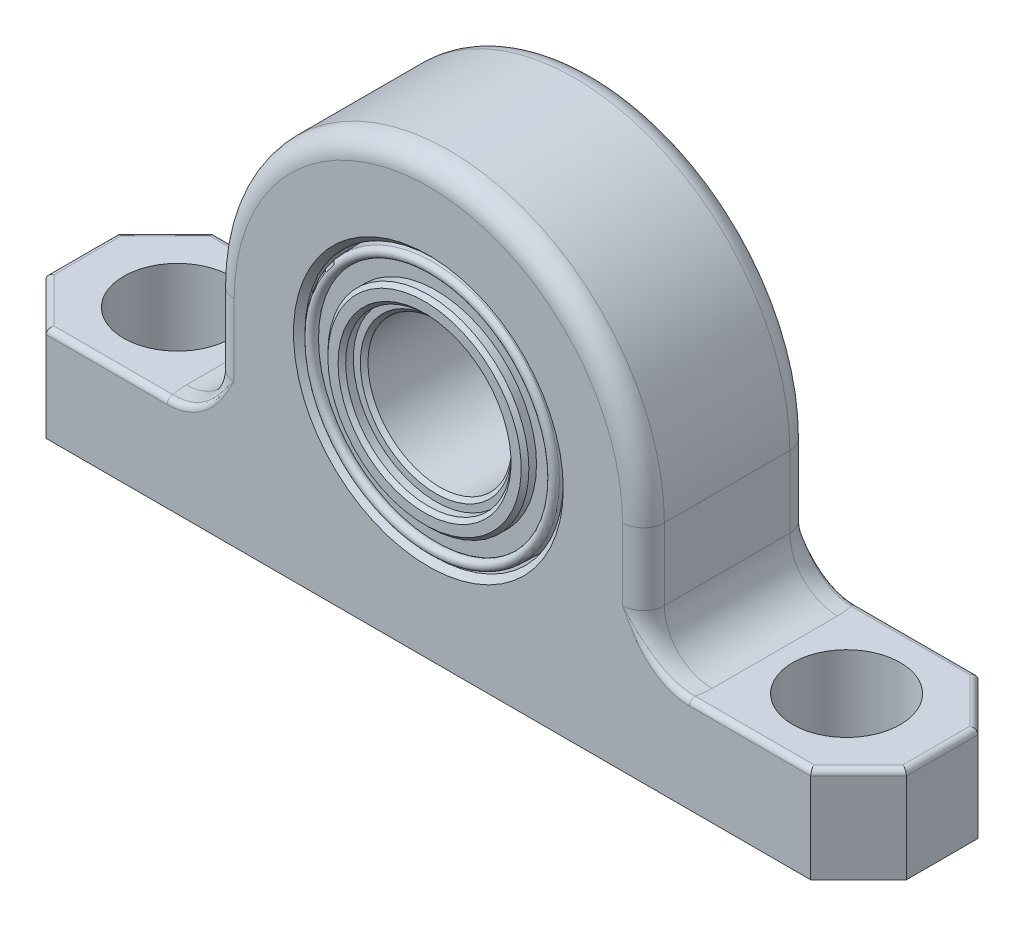
from build123d import *

# Parameters (mm, degrees)
BOSS_EXTRUDE1_DEPTH      = 5.55625
BOSS_EXTRUDE1_DEPTH_BACK = 5.55625
SKETCH3_R                = 8.58012
SKETCH4_R                = 3.571875
CUT_EXTRUDE1_DEPTH       = 41.791336875
CHAMFER1_SIZE            = 3.175
FILLET1_R                = 1.3890625
FILLET2_R                = 3.175
CHAMFER2_SIZE            = 0.381
FILLET3_R                = 0.381
CHAMFER3_SIZE            = 0.254


with BuildPart() as part:
    # Sketch3 → Boss-Extrude1 (new, two sides: drawn at the far end of the back side and taken through both)
    with BuildSketch(Plane.XY.offset(-BOSS_EXTRUDE1_DEPTH_BACK)):
        with BuildLine():
            Line((-28.575, 0), (-28.575, 6.35))
            Line((-28.575, 6.35), (-14.2875, 6.35))
            Line((-14.2875, 6.35), (-14.2875, 14.2875))
            ThreePointArc((-14.2875, 14.2875), (0, 28.575), (14.2875, 14.2875))
            Line((14.2875, 14.2875), (14.2875, 6.35))
            Line((14.2875, 6.35), (28.575, 6.35))
            Line((28.575, 6.35), (28.575, 0))
            Line((28.575, 0), (-28.575, 0))
        make_face()
        with Locations((0, 14.2875)):
            Circle(SKETCH3_R, mode=Mode.SUBTRACT)
    extrude(amount=BOSS_EXTRUDE1_DEPTH + BOSS_EXTRUDE1_DEPTH_BACK)

    # Sketch4 → Cut-Extrude1 (cut, through all)
    with BuildSketch(Plane(origin=(0, 0, 0), x_dir=(1, 0, 0), z_dir=(0, 1, 0))):
        with Locations(Location((-22.225, 0, 0), (0, 0, 270))):
            Circle(SKETCH4_R)
        with Locations(Location((22.225, 0, 0), (0, 0, 270))):
            Circle(SKETCH4_R)
    extrude(amount=CUT_EXTRUDE1_DEPTH, mode=Mode.SUBTRACT)

    # Chamfer1
    chamfer1_edges = [part.edges().sort_by_distance(p)[0] for p in [
        (28.575, 3.175, 5.55625),
        (-28.575, 3.175, -5.55625),
        (-28.575, 3.175, 5.55625),
        (28.575, 3.175, -5.55625),
    ]]
    chamfer(chamfer1_edges, length=CHAMFER1_SIZE)

    # Fillet1
    fillet1_edges = [part.edges().sort_by_distance(p)[0] for p in [
        (14.2875, 10.31875, -5.55625),
        (0, 28.575, -5.55625),
        (-14.2875, 10.31875, -5.55625),
        (14.2875, 10.31875, 5.55625),
        (0, 28.575, 5.55625),
        (-14.2875, 10.31875, 5.55625),
    ]]
    fillet(fillet1_edges, radius=FILLET1_R)

    # Fillet2
    # the kernel refuses this fillet: 3.175 mm, written as the material it adds along each edge
    with BuildSketch(Plane(origin=(-14.2875, 6.35, 4.1671875), x_dir=(-1, 0, 0), z_dir=(0, 0, -1))) as fillet2_piece_1:
        with BuildLine():
            CenterArc((FILLET2_R, FILLET2_R), FILLET2_R, 180, 90)
            Line((0, FILLET2_R), (0, 0))
            Line((0, 0), (FILLET2_R, 0))
        make_face()
    extrude(amount=8.334375)
    with BuildSketch(Plane(origin=(14.2875, 6.35, 4.1671875), x_dir=(1, 0, 0), z_dir=(0, 0, -1))) as fillet2_piece_2:
        with BuildLine():
            CenterArc((FILLET2_R, -FILLET2_R), FILLET2_R, 90, 90)
            Line((0, -FILLET2_R), (0, 0))
            Line((0, 0), (FILLET2_R, 0))
        make_face()
    extrude(amount=8.334375)
    with BuildSketch(Plane(origin=(-12.8984375, 6.35, -4.1671875), x_dir=(-0.9999802608561372, 0, 0.006283143965558251), z_dir=(-0.006283143965558251, 0, -0.9999802608561372))) as fillet2_piece_3_section:
        with BuildLine():
            CenterArc((1.3890625 + FILLET2_R, FILLET2_R), FILLET2_R, 180, 90)
            Line((1.3890625, FILLET2_R), (1.3890625, 0))
            Line((1.3890625, 0), (1.3890625 + FILLET2_R, 0))
        make_face()
    fillet2_piece_3 = revolve(axis=Axis((-12.8984375, 6.35, -4.1671875), (0, 1, 0)), revolution_arc=359.64, mode=Mode.PRIVATE)
    fillet2_piece_3 = split(fillet2_piece_3, bisect_by=Plane(origin=(-12.8984375, 6.35, -5.55625), z_dir=(0, 0, 1)), keep=Keep.TOP, mode=Mode.PRIVATE)
    add(fillet2_piece_3)
    with BuildSketch(Plane(origin=(-12.8984375, 6.35, 4.1671875), x_dir=(-0.9999802608561372, 0, -0.006283143965558251), z_dir=(-0.006283143965558251, 0, 0.9999802608561372))) as fillet2_piece_4_section:
        with BuildLine():
            CenterArc((1.3890625 + FILLET2_R, -FILLET2_R), FILLET2_R, 90, 90)
            Line((1.3890625, -FILLET2_R), (1.3890625, 0))
            Line((1.3890625, 0), (1.3890625 + FILLET2_R, 0))
        make_face()
    fillet2_piece_4 = revolve(axis=Axis((-12.8984375, 6.35, 4.1671875), (0, -1, 0)), revolution_arc=359.64, mode=Mode.PRIVATE)
    fillet2_piece_4 = split(fillet2_piece_4, bisect_by=Plane(origin=(-12.8984375, 6.35, 5.55625), z_dir=(0, 0, -1)), keep=Keep.TOP, mode=Mode.PRIVATE)
    add(fillet2_piece_4)
    with BuildSketch(Plane(origin=(12.8984375, 6.35, -4.1671875), x_dir=(0.9999802608561372, 0, 0.006283143965558251), z_dir=(0.006283143965558251, 0, -0.9999802608561372))) as fillet2_piece_5_section:
        with BuildLine():
            CenterArc((1.3890625 + FILLET2_R, -FILLET2_R), FILLET2_R, 90, 90)
            Line((1.3890625, -FILLET2_R), (1.3890625, 0))
            Line((1.3890625, 0), (1.3890625 + FILLET2_R, 0))
        make_face()
    fillet2_piece_5 = revolve(axis=Axis((12.8984375, 6.35, -4.1671875), (0, -1, 0)), revolution_arc=359.64, mode=Mode.PRIVATE)
    fillet2_piece_5 = split(fillet2_piece_5, bisect_by=Plane(origin=(12.8984375, 6.35, -5.55625), z_dir=(0, 0, 1)), keep=Keep.TOP, mode=Mode.PRIVATE)
    add(fillet2_piece_5)
    with BuildSketch(Plane(origin=(12.8984375, 6.35, 4.1671875), x_dir=(0.9999802608561372, 0, -0.006283143965558251), z_dir=(0.006283143965558251, 0, 0.9999802608561372))) as fillet2_piece_6_section:
        with BuildLine():
            CenterArc((1.3890625 + FILLET2_R, FILLET2_R), FILLET2_R, 180, 90)
            Line((1.3890625, FILLET2_R), (1.3890625, 0))
            Line((1.3890625, 0), (1.3890625 + FILLET2_R, 0))
        make_face()
    fillet2_piece_6 = revolve(axis=Axis((12.8984375, 6.35, 4.1671875), (0, 1, 0)), revolution_arc=359.64, mode=Mode.PRIVATE)
    fillet2_piece_6 = split(fillet2_piece_6, bisect_by=Plane(origin=(12.8984375, 6.35, 5.55625), z_dir=(0, 0, -1)), keep=Keep.TOP, mode=Mode.PRIVATE)
    add(fillet2_piece_6)

    # Chamfer2
    chamfer2_edges = [part.edges().sort_by_distance(p)[0] for p in [
        (-8.58012, 14.2875, -5.55625),
        (-8.58012, 14.2875, 5.55625),
    ]]
    chamfer(chamfer2_edges, length=CHAMFER2_SIZE)

    # Fillet3
    fillet3_edges = [part.edges().sort_by_distance(p)[0] for p in [
        (-21.32299265, 6.35, -5.55625),
        (-21.32299265, 6.35, 5.55625),
        (-14.671838579, 7.348302589, -5.55625),
        (-14.67183858, 7.348302588, 5.55625),
        (14.67183858, 7.348302588, -5.55625),
        (14.671838579, 7.348302589, 5.55625),
        (-28.575, 6.35, 0),
        (21.32299265, 6.35, -5.55625),
        (-26.9875, 6.35, 3.96875),
        (-26.9875, 6.35, -3.96875),
        (21.32299265, 6.35, 5.55625),
        (28.575, 6.35, 0),
        (26.9875, 6.35, -3.96875),
        (26.9875, 6.35, 3.96875),
    ]]
    fillet(fillet3_edges, radius=FILLET3_R)


with BuildPart() as body_2:
    # Sketch6 → Revolve1 (revolve)
    with BuildSketch(Plane(origin=(0, 0, 0), x_dir=(0, 0, -1), z_dir=(1, 0, 0)), mode=Mode.PRIVATE) as revolve1_sk:
        with BuildLine():
            Line((0, 22.86762), (5.55625, 22.86762))
            Line((5.55625, 22.86762), (5.55625, 22.092900628))
            Line((5.55625, 22.092900628), (1.74625, 22.092900628))
            Line((1.74625, 22.092900628), (1.74625, 20.96516))
            Line((1.74625, 20.96516), (4.28625, 20.96516))
            Line((4.28625, 20.96516), (4.28625, 19.77898))
            Line((4.28625, 19.77898), (3.52425, 19.77898))
            Line((3.52425, 19.77898), (3.52425, 19.0627))
            Line((3.52425, 19.0627), (-5.04825, 19.0627))
            Line((-5.04825, 19.0627), (-5.04825, 19.77898))
            Line((-5.04825, 19.77898), (-5.81025, 19.77898))
            Line((-5.81025, 19.77898), (-5.81025, 20.96516))
            Line((-5.81025, 20.96516), (-5.04825, 20.96516))
            Line((-5.04825, 20.96516), (-5.04825, 22.092900628))
            ThreePointArc((-5.04825, 22.092900628), (-5.539957431, 22.258816605), (-5.243179074, 22.684524152))
            Line((-5.243179074, 22.684524152), (0, 22.86762))
        make_face()
    revolve(revolve1_sk.sketch.rotate(Axis((0, 14.2875, 5.55625), (0, 0, -1)), 90), axis=Axis((0, 14.2875, 5.55625), (0, 0, -1)))

    # Chamfer3
    chamfer3_edges = [body_2.edges().sort_by_distance(p)[0] for p in [
        (-6.67766, 14.2875, -4.28625),
        (-5.49148, 14.2875, -4.28625),
        (-4.7752, 14.2875, -3.52425),
        (-4.7752, 14.2875, 5.04825),
        (-5.49148, 14.2875, 5.81025),
        (-6.67766, 14.2875, 5.81025),
    ]]
    chamfer(chamfer3_edges, length=CHAMFER3_SIZE)


solid = Compound([part.part, body_2.part])
